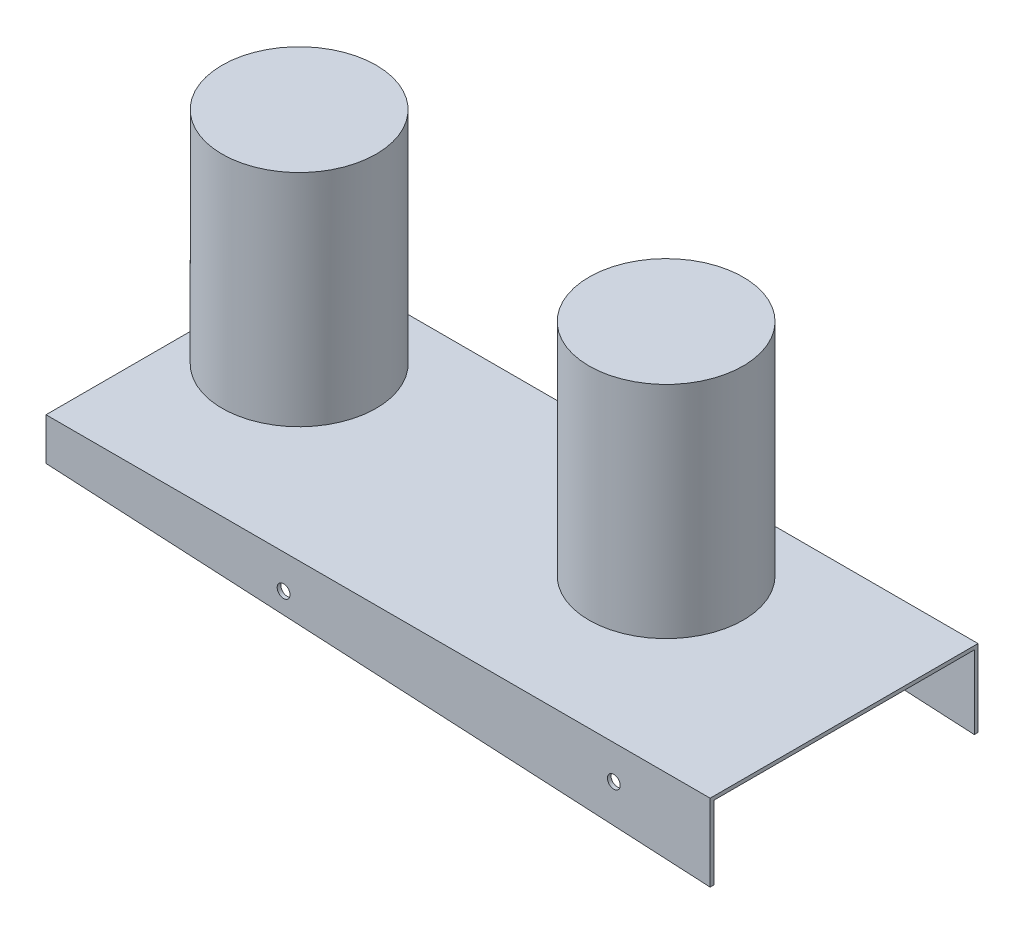
from build123d import *

# Parameters (mm, degrees)
SKETCH1_W               = 362
SKETCH1_H               = 146
BOSS_EXTRUDE1_DEPTH     = 2
SKETCH2_W               = 362
SKETCH2_H               = 2
BOSS_EXTRUDE2_DEPTH     = 42
CUT_EXTRUDE1_DEPTH      = 200.634666328
CUT_EXTRUDE1_DEPTH_BACK = 200.634666328
CUT_EXTRUDE2_DEPTH      = 200.634666328
CUT_EXTRUDE2_DEPTH_BACK = 200.634666328
SKETCH4_R               = 3.5
SKETCH5_R               = 42
BOSS_EXTRUDE3_DEPTH     = 120


with BuildPart() as part:
    # Sketch1 → Boss-Extrude1 (new body)
    with BuildSketch(Plane(origin=(0, 0, 0), x_dir=(1, 0, 0), z_dir=(0, 1, 0))):
        Rectangle(SKETCH1_W, SKETCH1_H)
    extrude(amount=-BOSS_EXTRUDE1_DEPTH)

    # Sketch2 → Boss-Extrude2 (add)
    with BuildSketch(Plane(origin=(0, 0, 0), x_dir=(1, 0, 0), z_dir=(0, 1, 0))):
        with Locations((0, 72)):
            Rectangle(SKETCH2_W, SKETCH2_H)
        with Locations((0, -72)):
            Rectangle(SKETCH2_W, SKETCH2_H)
    extrude(amount=-BOSS_EXTRUDE2_DEPTH)

    # Sketch3 → Cut-Extrude1 (cut, two sides: drawn at the far end of the back side and taken through both)
    with BuildSketch(Plane.XY.offset(-CUT_EXTRUDE1_DEPTH_BACK)):
        Polygon((-181, -23), (-181, -42), (181, -42), align=None)
    extrude(amount=CUT_EXTRUDE1_DEPTH + CUT_EXTRUDE1_DEPTH_BACK, mode=Mode.SUBTRACT)

    # Sketch4 → Cut-Extrude2 (cut, two sides: drawn at the far end of the back side and taken through both)
    with BuildSketch(Plane.XY.offset(-CUT_EXTRUDE2_DEPTH_BACK)):
        with Locations((128.5, -18.5)):
            Circle(SKETCH4_R)
        with Locations((-51.5, -18.5)):
            Circle(SKETCH4_R)
    extrude(amount=CUT_EXTRUDE2_DEPTH + CUT_EXTRUDE2_DEPTH_BACK, mode=Mode.SUBTRACT)

    # Sketch5 → Boss-Extrude3 (add)
    with BuildSketch(Plane(origin=(0, 0, 0), x_dir=(1, 0, 0), z_dir=(0, 1, 0))):
        with Locations((64, 20)):
            Circle(SKETCH5_R)
        with Locations((-136.025, 20)):
            Circle(SKETCH5_R)
    extrude(amount=BOSS_EXTRUDE3_DEPTH)


solid = part.part
